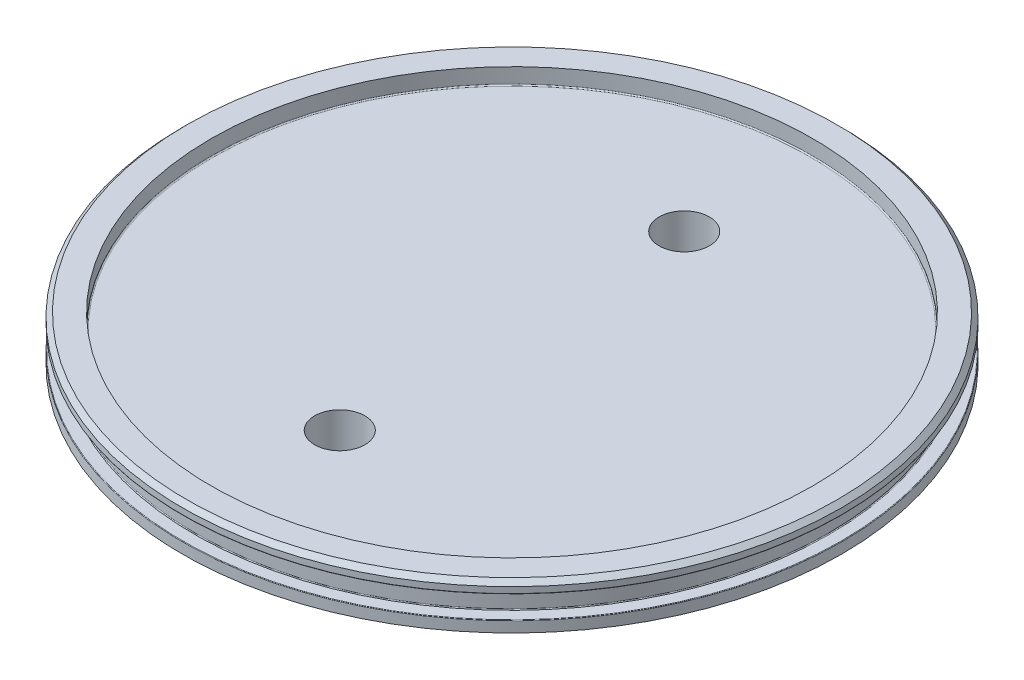
from build123d import *

# Parameters (mm, degrees)
SKETCH6_R                                = 66.04
BOSS_EXTRUDE1_DEPTH                      = 2.54
CNC_ID_FILLET_R                          = 0.1778
CNC_OD_FILLET_R                          = 0.127
CNC_CHAMFERS_SIZE                        = 1.016
CNC_BORE_FILLET_R                        = 0.254
PIPE_TAP_DRILL_FOR_1_4_TAP_RELIEF_VALV_D = 11.1252
PIPE_TAP_DRILL_FOR_1_4_TAP_VENT_VALVE_D  = 11.1252


with BuildPart() as part:
    # Sketch1 → Revolve1 (revolve)
    with BuildSketch(Plane.XY):
        Polygon((0, 0), (72.898, 0), (72.898, 2.4638), (70.0532, 2.4638), (70.0532, 7.4422), (72.898, 7.4422), (72.898, 9.906), (66.548, 9.906), (66.548, 6.35), (0, 6.35), align=None)
    revolve(axis=Axis((0, 48.192213231, 0), (0, -1, 0)))

    # Sketch6 → Boss-Extrude1 (add)
    with BuildSketch(Plane.XZ):
        Circle(SKETCH6_R)
    extrude(amount=BOSS_EXTRUDE1_DEPTH)

    # CNC ID Fillet
    cnc_id_fillet_edges = [part.edges().sort_by_distance(p)[0] for p in [
        (-70.0532, 7.4422, 0),
        (-70.0532, 2.4638, 0),
        (-66.04, 0, 0),
    ]]
    fillet(cnc_id_fillet_edges, radius=CNC_ID_FILLET_R)

    # CNC OD Fillet
    cnc_od_fillet_edges = [part.edges().sort_by_distance(p)[0] for p in [
        (-72.898, 7.4422, 0),
        (-72.898, 2.4638, 0),
        (-66.04, -2.54, 0),
    ]]
    fillet(cnc_od_fillet_edges, radius=CNC_OD_FILLET_R)

    # CNC Chamfers
    cnc_chamfers_edges = [part.edges().sort_by_distance(p)[0] for p in [
        (-72.898, 9.906, 0),
    ]]
    chamfer(cnc_chamfers_edges, length=CNC_CHAMFERS_SIZE)

    # CNC Bore Fillet
    cnc_bore_fillet_edges = [part.edges().sort_by_distance(p)[0] for p in [
        (-66.548, 6.35, 0),
    ]]
    fillet(cnc_bore_fillet_edges, radius=CNC_BORE_FILLET_R)

    # Pipe Tap Drill for 1/4 Tap - Relief Valve (through all)
    with Locations(Plane(origin=(0, -2.54, 0), x_dir=(-1, 0, 0), z_dir=(0, -1, 0))):
        with Locations((0, 38.1)):
            Hole(PIPE_TAP_DRILL_FOR_1_4_TAP_RELIEF_VALV_D / 2)

    # Pipe Tap Drill for 1/4 Tap - Vent Valve (through all)
    with Locations(Plane(origin=(0, -2.54, 0), x_dir=(-1, 0, 0), z_dir=(0, -1, 0))):
        with Locations((0, -38.1)):
            Hole(PIPE_TAP_DRILL_FOR_1_4_TAP_VENT_VALVE_D / 2)


solid = part.part
